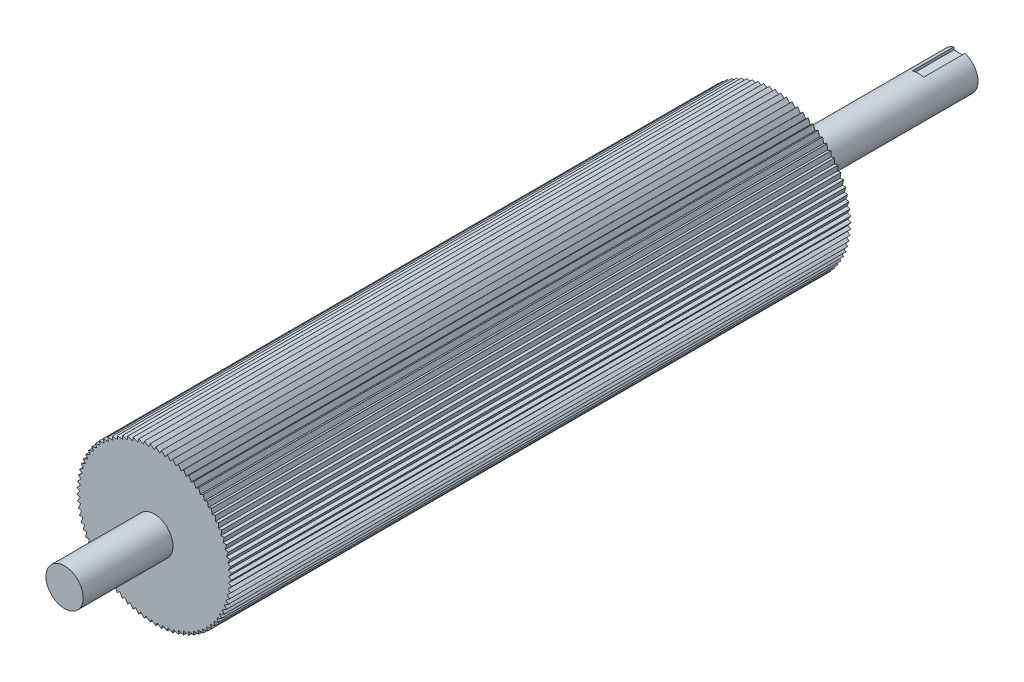
from build123d import *

# Parameters (mm, degrees)
SKETCH2_R           = 125
BOSS_EXTRUDE1_DEPTH = 500
SKETCH3_R           = 30
BOSS_EXTRUDE2_DEPTH = 145
BOSS_EXTRUDE3_START = 300
SKETCH4_R           = 30
BOSS_EXTRUDE3_DEPTH = 300
CUT_EXTRUDE6_DEPTH  = 1000
CIRPATTERN1_COUNT   = 85
SKETCH16_W          = 18
SKETCH16_H          = 11
CUT_EXTRUDE7_DEPTH  = 67


with BuildPart() as part:
    # Sketch2 → Boss-Extrude1 (new, symmetric)
    with BuildSketch(Plane.XY):
        Circle(SKETCH2_R)
    extrude(amount=BOSS_EXTRUDE1_DEPTH, both=True)

    # Sketch3 → Boss-Extrude2 (add)
    with BuildSketch(Plane.XY.offset(500)):
        Circle(SKETCH3_R)
    extrude(amount=BOSS_EXTRUDE2_DEPTH)

    # Sketch4 → Boss-Extrude3 (add)
    with BuildSketch(Plane(origin=(0, 0, -500), x_dir=(-1, 0, 0), z_dir=(0, 0, -1)).offset(BOSS_EXTRUDE3_START)):
        with Locations(Location((0, 0, 0), (0, 0, 180))):
            Circle(SKETCH4_R)
    extrude(amount=-BOSS_EXTRUDE3_DEPTH)

    # Sketch15 → Cut-Extrude6 (cut)
    with BuildSketch(Plane.XY.offset(500)):
        with BuildLine():
            Line((0, 120), (2.321485149, 124.978440968))
            ThreePointArc((2.321485149, 124.978440968), (-2.276223403, 124.97927351), (-6.870852473, 124.811022695))
            Line((-6.870852473, 124.811022695), (0, 120))
        make_face()
    cut_extrude6 = extrude(amount=-CUT_EXTRUDE6_DEPTH, mode=Mode.SUBTRACT)

    # CirPattern1: Cut-Extrude6 ×85 about axis
    cirpattern1_axis = Axis((0, 0, 0), (0, 0, 1))
    for i in range(1, CIRPATTERN1_COUNT):
        add(cut_extrude6.rotate(cirpattern1_axis, i * 360 / CIRPATTERN1_COUNT), mode=Mode.SUBTRACT)

    # Sketch16 → Cut-Extrude7 (cut)
    with BuildSketch(Plane(origin=(0, 0, -800), x_dir=(-1, 0, 0), z_dir=(0, 0, -1))):
        with Locations((0, 30)):
            Rectangle(SKETCH16_W, SKETCH16_H)
    extrude(amount=-CUT_EXTRUDE7_DEPTH, mode=Mode.SUBTRACT)


solid = part.part
